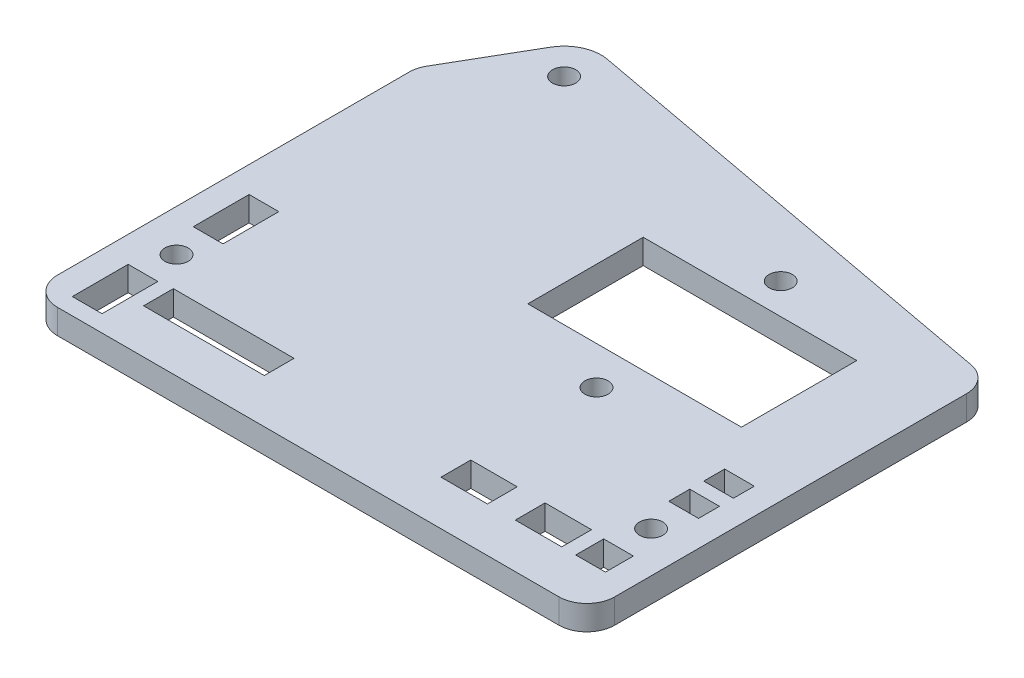
from build123d import *

# Parameters (mm, degrees)
SKETCH1_W           = 3.194434014
SKETCH1_H           = 6.000224533
SKETCH1_W_2         = 12.976803263
SKETCH1_H_2         = 3.200223762
SKETCH1_R           = 1.25
SKETCH1_H_3         = 6.000288014
SKETCH1_W_3         = 4.991186163
SKETCH1_H_4         = 3.200091917
SKETCH1_W_4         = 4.990971694
SKETCH1_W_5         = 3.194492506
SKETCH1_H_5         = 3.000146449
SKETCH1_H_6         = 2.247069465
SKETCH1_W_6         = 22.959409558
SKETCH1_H_7         = 12.40053533
BOSS_EXTRUDE1_DEPTH = 2.646066576


with BuildPart() as part:
    # Sketch1 → Boss-Extrude1 (new body)
    with BuildSketch(Plane(origin=(0, 0, 0), x_dir=(1, 0, 0), z_dir=(0, 1, 0))):
        with BuildLine():
            Line((-28.456084878, -27.532431428), (25.442900716, -27.532431428))
            ThreePointArc((25.442900716, -27.532431428), (27.560473935, -26.65530708), (28.437609204, -24.537738386))
            Line((28.437609204, -24.537738386), (28.437804204, 13.268980227))
            ThreePointArc((28.437804204, 13.268980227), (27.743957441, 15.188191581), (25.983223234, 16.219991273))
            Line((25.983223234, 16.219991273), (-21.997773241, 25.107497345))
            ThreePointArc((-21.997773241, 25.107497345), (-24.390968499, 24.809261571), (-26.174789125, 23.186205164))
            Line((-26.174789125, 23.186205164), (-31.050867612, 14.775968165))
            ThreePointArc((-31.050867612, 14.775968165), (-31.352979308, 14.049412081), (-31.456040564, 13.269326446))
            Line((-31.456040564, 13.269326446), (-31.456040564, -24.532475742))
            ThreePointArc((-31.456040564, -24.532475742), (-30.577373887, -26.653764751), (-28.456084878, -27.532431428))
        make_face()
        with Locations((-27.063830276, -22.732321631)):
            Rectangle(SKETCH1_W, SKETCH1_H, mode=Mode.SUBTRACT)
        with Locations((-17.481737065, -21.16687035)):
            Rectangle(SKETCH1_W_2, SKETCH1_H_2, mode=Mode.SUBTRACT)
        with Locations((-26.963965218, -16.232064957)):
            Circle(SKETCH1_R, mode=Mode.SUBTRACT)
        with Locations((-27.063830275, -9.731776544)):
            Rectangle(SKETCH1_W, SKETCH1_H_3, mode=Mode.SUBTRACT)
        with Locations((10.460708795, -21.132309856)):
            Rectangle(SKETCH1_W_3, SKETCH1_H_4, mode=Mode.SUBTRACT)
        with Locations((18.446511119, -21.132309856)):
            Rectangle(SKETCH1_W_4, SKETCH1_H_4, mode=Mode.SUBTRACT)
        with Locations((24.045427435, -21.232282591)):
            Rectangle(SKETCH1_W_5, SKETCH1_H_5, mode=Mode.SUBTRACT)
        with Locations((24.045515173, -16.23206496)):
            Circle(SKETCH1_R, mode=Mode.SUBTRACT)
        with Locations((7.974006472, -6.031549942)):
            Circle(SKETCH1_R, mode=Mode.SUBTRACT)
        Polygon((22.448181182, -10.484914569), (22.448181182, -10.478708085), (25.642673688, -10.478708085), (25.642673688, -12.731920553), (22.448181182, -12.731920553), align=None, mode=Mode.SUBTRACT)
        with Locations((24.045427436, -7.855167272)):
            Rectangle(SKETCH1_W_5, SKETCH1_H_6, mode=Mode.SUBTRACT)
        with Locations((-22.724218332, 21.185636807)):
            Circle(SKETCH1_R, mode=Mode.SUBTRACT)
        with Locations((7.974006472, 4.268713184)):
            Rectangle(SKETCH1_W_6, SKETCH1_H_7, mode=Mode.SUBTRACT)
        with Locations((7.974006473, 13.76898446)):
            Circle(SKETCH1_R, mode=Mode.SUBTRACT)
    extrude(amount=BOSS_EXTRUDE1_DEPTH)


solid = part.part
